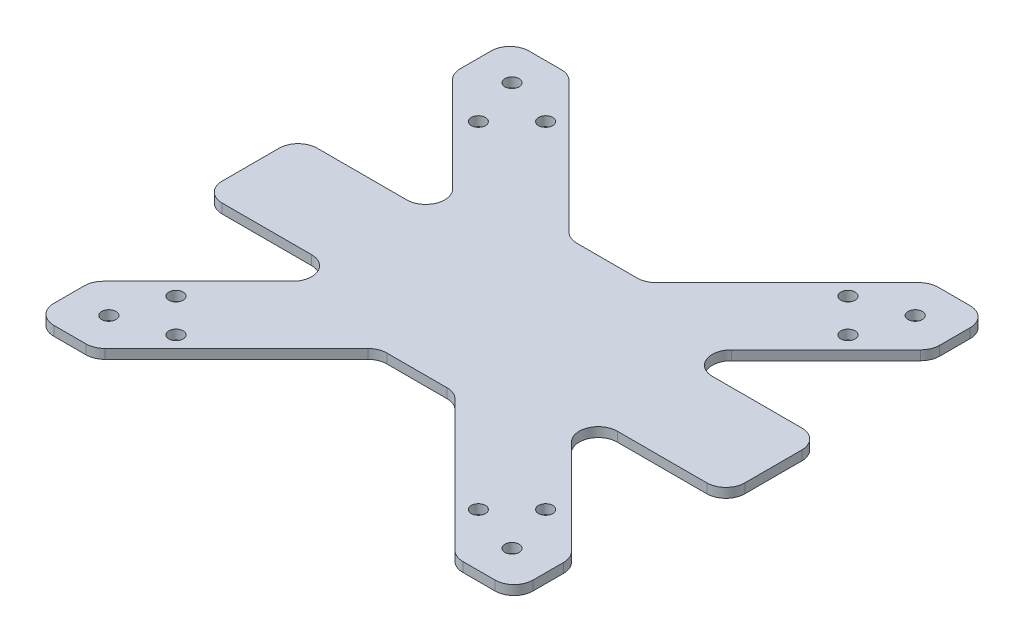
from build123d import *

# Parameters (mm, degrees)
SKETCH_1_W          = 120
SKETCH_1_H          = 100
EXTRUDE_1_DEPTH     = 2
SKETCH_3_R          = 1.5
CUT_EXTRUDE_2_DEPTH = 79.128099938
CUT_EXTRUDE_3_DEPTH = 79.128099938
SKETCH_7_W          = 110
SKETCH_7_H          = 20
EXTRUDE_3_DEPTH     = 2
SKETCH_8_W          = 35.706411965
SKETCH_8_H          = 36.858231705
CUT_EXTRUDE_5_DEPTH = 79.128099938
FILLET_2_R          = 4


with BuildPart() as part:
    # 草图1 → 凸台-拉伸1 (new body)
    with BuildSketch(Plane(origin=(0, 0, 0), x_dir=(1, 0, 0), z_dir=(0, 1, 0))):
        Rectangle(SKETCH_1_W, SKETCH_1_H)
    extrude(amount=EXTRUDE_1_DEPTH)

    # 草图3 → 切除-拉伸2 (cut, through all)
    with BuildSketch(Plane(origin=(0, 2, 0), x_dir=(1, 0, 0), z_dir=(0, 1, 0))):
        with Locations((-42.426406871, 42.426406871)):
            Circle(SKETCH_3_R)
        with Locations((-31.819805153, 38.890872965)):
            Circle(SKETCH_3_R)
        with Locations((-38.890872965, 31.819805153)):
            Circle(SKETCH_3_R)
        with Locations((-31.819805153, -38.890872965)):
            Circle(SKETCH_3_R)
        with Locations((-38.890872965, -31.819805153)):
            Circle(SKETCH_3_R)
        with Locations((-42.426406871, -42.426406871)):
            Circle(SKETCH_3_R)
        with Locations((31.819805153, 38.890872965)):
            Circle(SKETCH_3_R)
        with Locations((38.890872965, 31.819805153)):
            Circle(SKETCH_3_R)
        with Locations((42.426406871, 42.426406871)):
            Circle(SKETCH_3_R)
        with Locations((31.819805153, -38.890872965)):
            Circle(SKETCH_3_R)
        with Locations((42.426406871, -42.426406871)):
            Circle(SKETCH_3_R)
        with Locations((38.890872965, -31.819805153)):
            Circle(SKETCH_3_R)
    extrude(amount=-CUT_EXTRUDE_2_DEPTH, mode=Mode.SUBTRACT)

    # 草图4 → 切除-拉伸3 (cut, through all)
    with BuildSketch(Plane.XZ):
        Polygon((-38, 50), (-8, 20), (8, 20), (38, 50), align=None)
        Polygon((8, -20), (38, -50), (-38, -50), (-8, -20), align=None)
        Polygon((-60, 47.5), (-20, 7.5), (-20, -7.5), (-60, -47.5), align=None)
        Polygon((20, -7.5), (60, -47.5), (60, 47.5), (20, 7.5), align=None)
    extrude(amount=-CUT_EXTRUDE_3_DEPTH, mode=Mode.SUBTRACT)

    # 草图7 → 凸台-拉伸3 (add)
    with BuildSketch(Plane(origin=(0, 2, 0), x_dir=(1, 0, 0), z_dir=(0, 1, 0))):
        Rectangle(SKETCH_7_W, SKETCH_7_H)
    extrude(amount=-EXTRUDE_3_DEPTH)

    # 草图8 → 切除-拉伸5 (cut, through all)
    with BuildSketch(Plane.XZ):
        with Locations((-68.279612853, 48.951539573)):
            Rectangle(SKETCH_8_W, SKETCH_8_H)
        with Locations((-68.279612853, -48.951539573)):
            Rectangle(SKETCH_8_W, SKETCH_8_H)
        with Locations((68.279612853, -48.951539573)):
            Rectangle(SKETCH_8_W, SKETCH_8_H)
        with Locations((68.279612853, 48.951539573)):
            Rectangle(SKETCH_8_W, SKETCH_8_H)
    extrude(amount=-CUT_EXTRUDE_5_DEPTH, mode=Mode.SUBTRACT)

    # 圆角2
    fillet_2_edges = [part.edges().sort_by_distance(p)[0] for p in [
        (-8, 1, -20),
        (8, 1, -20),
        (-8, 1, 20),
        (8, 1, 20),
        (-22.5, 1, 10),
        (-55, 1, 10),
        (-55, 1, -10),
        (-22.5, 1, -10),
        (-50.426406871, 1, -37.926406871),
        (-50.426406871, 1, -50),
        (-38, 1, -50),
        (50.426406871, 1, -37.926406871),
        (38, 1, -50),
        (50.426406871, 1, -50),
        (22.5, 1, 10),
        (22.5, 1, -10),
        (55, 1, 10),
        (55, 1, -10),
        (50.426406871, 1, 37.926406871),
        (50.426406871, 1, 50),
        (38, 1, 50),
        (-38, 1, 50),
        (-50.426406871, 1, 37.926406871),
        (-50.426406871, 1, 50),
    ]]
    fillet(fillet_2_edges, radius=FILLET_2_R)


solid = part.part
